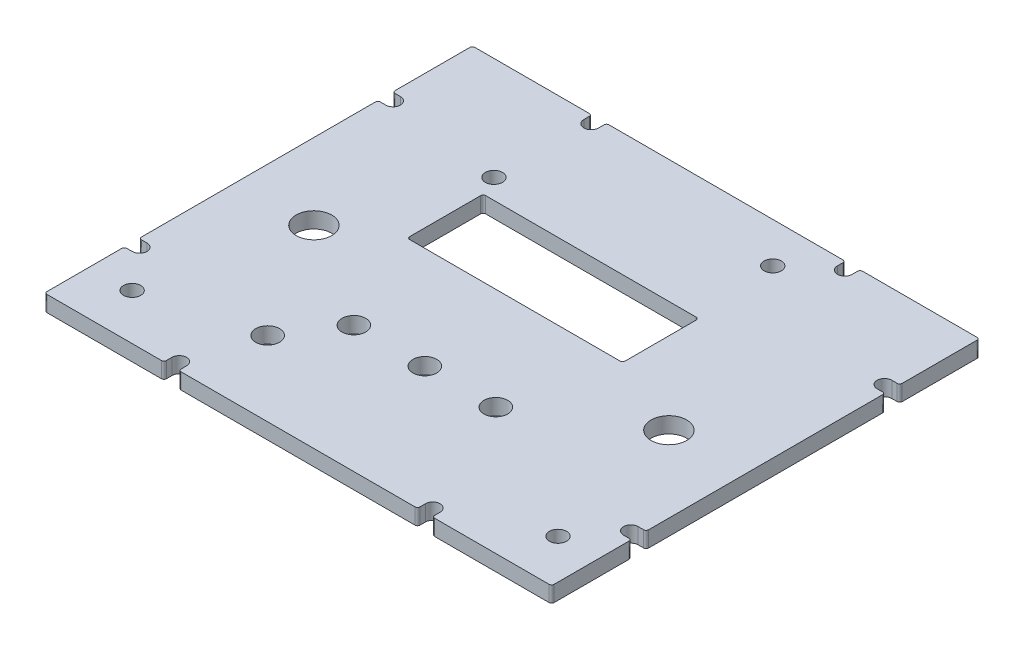
from build123d import *

# Parameters (mm, degrees)
SKETCH1_W                       = 101.6
SKETCH1_H                       = 85.725
BOSS_EXTRUDE1_DEPTH             = 3.175
F_29_0_136_DIAMETER_HOLE1_D     = 3.4544
F_9_32_0_28125_DIAMETER_HOLE1_D = 7.14375
F_3_16_0_1875_DIAMETER_HOLE1_D  = 4.7625
SKETCH8_W                       = 43.18
SKETCH8_H                       = 15.24
CUT_EXTRUDE1_DEPTH              = 67.542576831
CUT_EXTRUDE2_DEPTH              = 67.542576831
FILLET1_R                       = 0.508
CUT_EXTRUDE3_DEPTH              = 67.542576831
FILLET2_R                       = 0.508


with BuildPart() as part:
    # Sketch1 → Boss-Extrude1 (new body)
    with BuildSketch(Plane(origin=(0, 0, 0), x_dir=(1, 0, 0), z_dir=(0, 1, 0))):
        Rectangle(SKETCH1_W, SKETCH1_H)
    extrude(amount=BOSS_EXTRUDE1_DEPTH)

    # #29 (0.136) Diameter Hole1 (through all)
    with Locations(Plane(origin=(0, 3.175, 0), x_dir=(1, 0, 0), z_dir=(0, 1, 0))):
        with Locations((-25.8318, 22.2123), (17.4498, 34.7853), (42.8498, -33.6423), (-42.4688, -33.6423)):
            Hole(F_29_0_136_DIAMETER_HOLE1_D / 2)

    # 9/32 (0.28125) Diameter Hole1 (through all)
    with Locations(Plane(origin=(0, 3.175, 0), x_dir=(1, 0, 0), z_dir=(0, 1, 0))):
        with Locations((-35.56, -4.1275), (35.56, -4.1275)):
            Hole(F_9_32_0_28125_DIAMETER_HOLE1_D / 2)

    # 3/16 (0.1875) Diameter Hole1 (through all)
    with Locations(Plane(origin=(0, 3.175, 0), x_dir=(1, 0, 0), z_dir=(0, 1, 0))):
        with Locations((-14.224, -17.4625), (0, -17.4625), (14.224, -17.4625), (-21.082, -27.8765)):
            Hole(F_3_16_0_1875_DIAMETER_HOLE1_D / 2)

    # Sketch8 → Cut-Extrude1 (cut, through all)
    with BuildSketch(Plane(origin=(0, 3.175, 0), x_dir=(1, 0, 0), z_dir=(0, 1, 0))):
        with Locations((-2.413, 10.6045)):
            Rectangle(SKETCH8_W, SKETCH8_H)
    extrude(amount=-CUT_EXTRUDE1_DEPTH, mode=Mode.SUBTRACT)

    # Sketch9 → Cut-Extrude2 (cut, through all)
    with BuildSketch(Plane(origin=(0, 3.175, 0), x_dir=(1, 0, 0), z_dir=(0, 1, 0))):
        with BuildLine():
            Line((-49.2125, 26.8732), (-50.8, 26.8732))
            Line((-50.8, 26.8732), (-50.8, 23.9268))
            Line((-50.8, 23.9268), (-49.2125, 23.9268))
            ThreePointArc((-49.2125, 23.9268), (-47.7393, 25.4), (-49.2125, 26.8732))
        make_face()
        with BuildLine():
            Line((-49.2125, -23.9268), (-50.8, -23.9268))
            Line((-50.8, -23.9268), (-50.8, -26.8732))
            Line((-50.8, -26.8732), (-49.2125, -26.8732))
            ThreePointArc((-49.2125, -26.8732), (-47.7393, -25.4), (-49.2125, -23.9268))
        make_face()
        with BuildLine():
            Line((49.2125, -26.8732), (50.8, -26.8732))
            Line((50.8, -26.8732), (50.8, -23.9268))
            Line((50.8, -23.9268), (49.2125, -23.9268))
            ThreePointArc((49.2125, -23.9268), (47.7393, -25.4), (49.2125, -26.8732))
        make_face()
        with BuildLine():
            Line((50.8, 26.8732), (50.8, 23.9268))
            Line((50.8, 23.9268), (49.2125, 23.9268))
            ThreePointArc((49.2125, 23.9268), (47.7393, 25.4), (49.2125, 26.8732))
            Line((49.2125, 26.8732), (50.8, 26.8732))
        make_face()
    extrude(amount=-CUT_EXTRUDE2_DEPTH, mode=Mode.SUBTRACT)

    # Fillet1
    fillet1_edges = [part.edges().sort_by_distance(p)[0] for p in [
        (50.8, 1.5875, -23.9268),
        (50.8, 1.5875, -26.8732),
        (50.8, 1.5875, 23.9268),
        (50.8, 1.5875, 26.8732),
        (-50.8, 1.5875, 23.9268),
        (-50.8, 1.5875, 26.8732),
        (-50.8, 1.5875, -23.9268),
        (-50.8, 1.5875, -26.8732),
        (-24.003, 1.5875, -2.9845),
        (19.177, 1.5875, -2.9845),
        (19.177, 1.5875, -18.2245),
        (-24.003, 1.5875, -18.2245),
    ]]
    fillet(fillet1_edges, radius=FILLET1_R)

    # Sketch10 → Cut-Extrude3 (cut, through all)
    with BuildSketch(Plane(origin=(0, 3.175, 0), x_dir=(1, 0, 0), z_dir=(0, 1, 0))):
        with BuildLine():
            Line((-23.9268, 41.275), (-23.9268, 42.8625))
            Line((-23.9268, 42.8625), (-26.8732, 42.8625))
            Line((-26.8732, 42.8625), (-26.8732, 41.275))
            ThreePointArc((-26.8732, 41.275), (-25.4, 39.8018), (-23.9268, 41.275))
        make_face()
        with BuildLine():
            Line((26.8732, -41.275), (26.8732, -42.8625))
            Line((26.8732, -42.8625), (23.9268, -42.8625))
            Line((23.9268, -42.8625), (23.9268, -41.275))
            ThreePointArc((23.9268, -41.275), (25.4, -39.8018), (26.8732, -41.275))
        make_face()
        with BuildLine():
            Line((-23.9268, -41.275), (-23.9268, -42.8625))
            Line((-23.9268, -42.8625), (-26.8732, -42.8625))
            Line((-26.8732, -42.8625), (-26.8732, -41.275))
            ThreePointArc((-26.8732, -41.275), (-25.4, -39.8018), (-23.9268, -41.275))
        make_face()
        with BuildLine():
            Line((26.8732, 42.8625), (23.9268, 42.8625))
            Line((23.9268, 42.8625), (23.9268, 41.275))
            ThreePointArc((23.9268, 41.275), (25.4, 39.8018), (26.8732, 41.275))
            Line((26.8732, 41.275), (26.8732, 42.8625))
        make_face()
    extrude(amount=-CUT_EXTRUDE3_DEPTH, mode=Mode.SUBTRACT)

    # Fillet2
    fillet2_edges = [part.edges().sort_by_distance(p)[0] for p in [
        (26.8732, 1.5875, -42.8625),
        (23.9268, 1.5875, -42.8625),
        (-26.8732, 1.5875, -42.8625),
        (-23.9268, 1.5875, -42.8625),
        (-23.9268, 1.5875, 42.8625),
        (-26.8732, 1.5875, 42.8625),
        (23.9268, 1.5875, 42.8625),
        (26.8732, 1.5875, 42.8625),
        (50.8, 1.5875, 42.8625),
        (50.8, 1.5875, -42.8625),
        (-50.8, 1.5875, -42.8625),
        (-50.8, 1.5875, 42.8625),
    ]]
    fillet(fillet2_edges, radius=FILLET2_R)


solid = part.part
